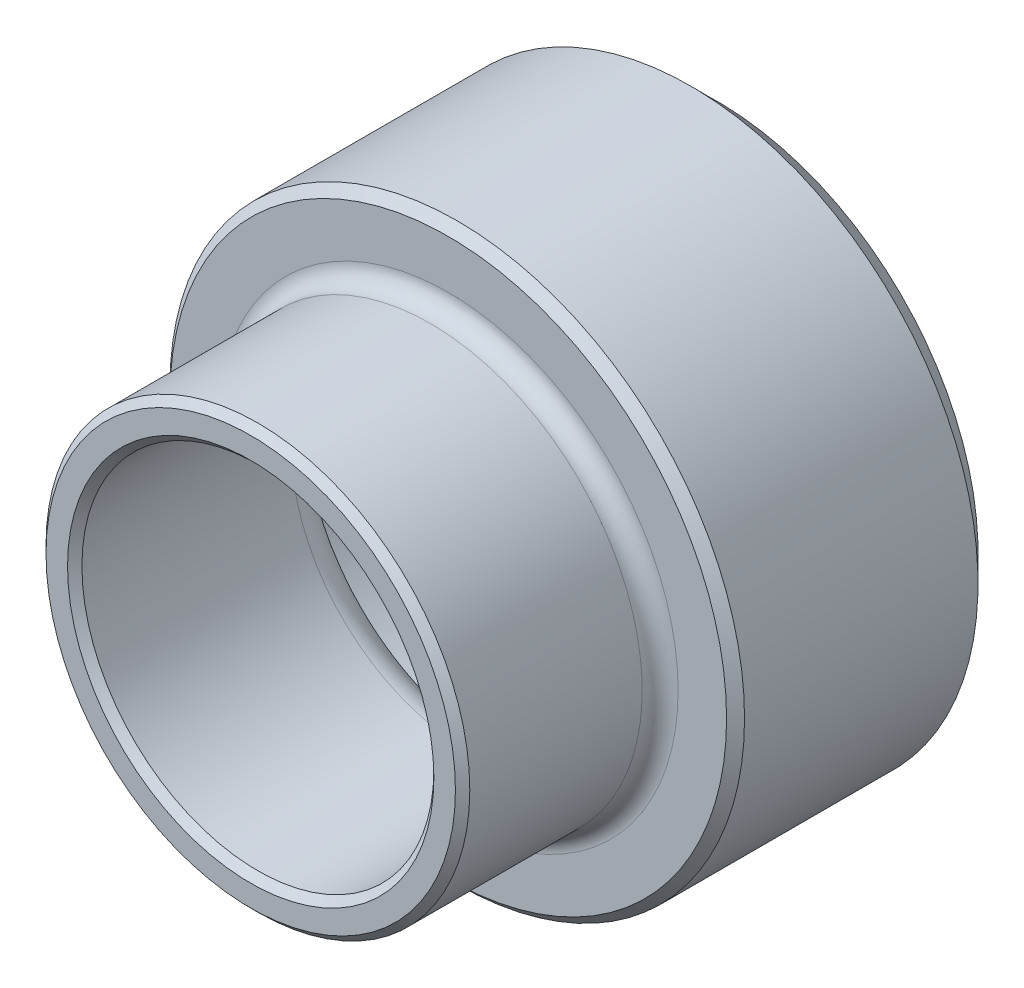
from build123d import *

# Parameters (mm, degrees)
F_12_0_12_DIAMETER_HOLE1_D     = 12
F_12_0_12_DIAMETER_HOLE1_DEPTH = 5.75
F_12_0_12_DIAMETER_HOLE1_TIP   = 3.605163714
CHAMFER1_SIZE                  = 0.75
CHAMFER2_SIZE                  = 0.25
CHAMFER3_SIZE                  = 0.2
FILLET1_R                      = 1


with BuildPart() as part:
    # Sketch1 → Revolve1 (revolve)
    with BuildSketch(Plane.XZ):
        with BuildLine():
            Line((5.9, 13), (4.9, 13))
            Line((4.9, 13), (4.9, 5.75))
            Line((4.9, 5.75), (0, 5.75))
            Line((0, 5.75), (0, 0))
            Line((0, 0), (8, 0))
            Line((8, 0), (8, 7.5))
            Line((8, 7.5), (6.4, 7.5))
            ThreePointArc((6.4, 7.5), (6.046446609, 7.646446609), (5.9, 8))
            Line((5.9, 8), (5.9, 13))
        make_face()
    revolve(axis=Axis((0, 0, 13), (0, 0, -1)))

    # Ø12.0 (12) Diameter Hole1
    with Locations(Plane(origin=(0, 0, 0), x_dir=(-1, 0, 0), z_dir=(0, 0, -1))):
        with Locations((0, 0)):
            Hole(F_12_0_12_DIAMETER_HOLE1_D / 2, depth=F_12_0_12_DIAMETER_HOLE1_DEPTH)
            with Locations((0, 0, -(F_12_0_12_DIAMETER_HOLE1_DEPTH + F_12_0_12_DIAMETER_HOLE1_TIP / 2))):  # 118° drill point
                Cone(0, F_12_0_12_DIAMETER_HOLE1_D / 2, F_12_0_12_DIAMETER_HOLE1_TIP, mode=Mode.SUBTRACT)

    # Chamfer1
    chamfer1_edges = [part.edges().sort_by_distance(p)[0] for p in [
        (-8, 0, 0),
    ]]
    chamfer(chamfer1_edges, length=CHAMFER1_SIZE)

    # Chamfer2
    chamfer2_edges = [part.edges().sort_by_distance(p)[0] for p in [
        (-8, 0, 7.5),
    ]]
    chamfer(chamfer2_edges, length=CHAMFER2_SIZE)

    # Chamfer3
    chamfer3_edges = [part.edges().sort_by_distance(p)[0] for p in [
        (-5.9, 0, 13),
        (-4.9, 0, 13),
        (-6, 0, 0),
    ]]
    chamfer(chamfer3_edges, length=CHAMFER3_SIZE)

    # Fillet1
    fillet1_edges = [part.edges().sort_by_distance(p)[0] for p in [
        (0, -4.9, 6.410946681),
    ]]
    fillet(fillet1_edges, radius=FILLET1_R)


solid = part.part
